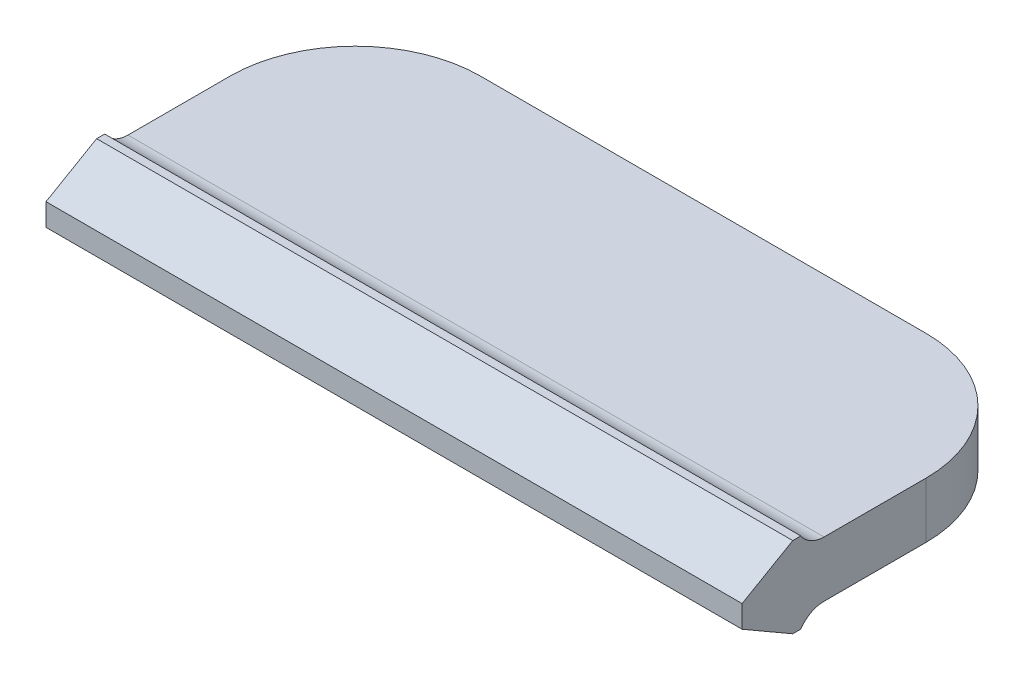
from build123d import *

# Parameters (mm, degrees)
CONNECTION_EXTRUDE_DEPTH = 25
TOP_FILLETS_R            = 4.5
CONNECTION_FILLETS_R     = 1


with BuildPart() as part:
    # Connection Sketch → Connection Extrude (new body)
    with BuildSketch(Plane(origin=(0, 0, 0), x_dir=(0, 0, -1), z_dir=(1, 0, 0))):
        Polygon((0, 1.45), (0, 1), (9, 1), (9, -1), (0, -1), (0, -1.45), (-0.288526329, -1.45), (-2.107179677, -0.4), (-2.107179677, 0.4), (-0.288526329, 1.45), align=None)
    extrude(amount=CONNECTION_EXTRUDE_DEPTH)

    # Top Fillets
    top_fillets_edges = [part.edges().sort_by_distance(p)[0] for p in [
        (0, 0, -9),
        (25, 0, -9),
    ]]
    fillet(top_fillets_edges, radius=TOP_FILLETS_R)

    # Connection Fillets
    # the kernel refuses this fillet: 1 mm, written as the material it adds along each edge
    with BuildSketch(Plane(origin=(0, 1, 0), x_dir=(0, 0, -1), z_dir=(1, 0, 0))) as connection_fillets_piece_1:
        with BuildLine():
            CenterArc((0.835164654, 1), CONNECTION_FILLETS_R, 213.367012969, 56.632987031)
            Line((0, 0.45), (-0.016703293, 0.439))
            ThreePointArc((-0.016703293, 0.439), (-0.02, 0.225), (-0.02, 0))
            Line((-0.02, 0), (0, -0.02))
            Line((0, -0.02), (0.835164654, -0.02))
            Line((0.835164654, -0.02), (0.835164654, 0))
        make_face()
    extrude(amount=25)
    with BuildSketch(Plane(origin=(0, -1, 0), x_dir=(0, 0, -1), z_dir=(1, 0, 0))) as connection_fillets_piece_2:
        with BuildLine():
            CenterArc((0.835164654, -1), CONNECTION_FILLETS_R, 90, 56.632987031)
            Line((0, -0.45), (-0.016703293, -0.439))
            ThreePointArc((-0.016703293, -0.439), (-0.02, -0.225), (-0.02, 0))
            Line((-0.02, 0), (0, 0.02))
            Line((0, 0.02), (0.835164654, 0.02))
            Line((0.835164654, 0.02), (0.835164654, 0))
        make_face()
    extrude(amount=25)


solid = part.part
